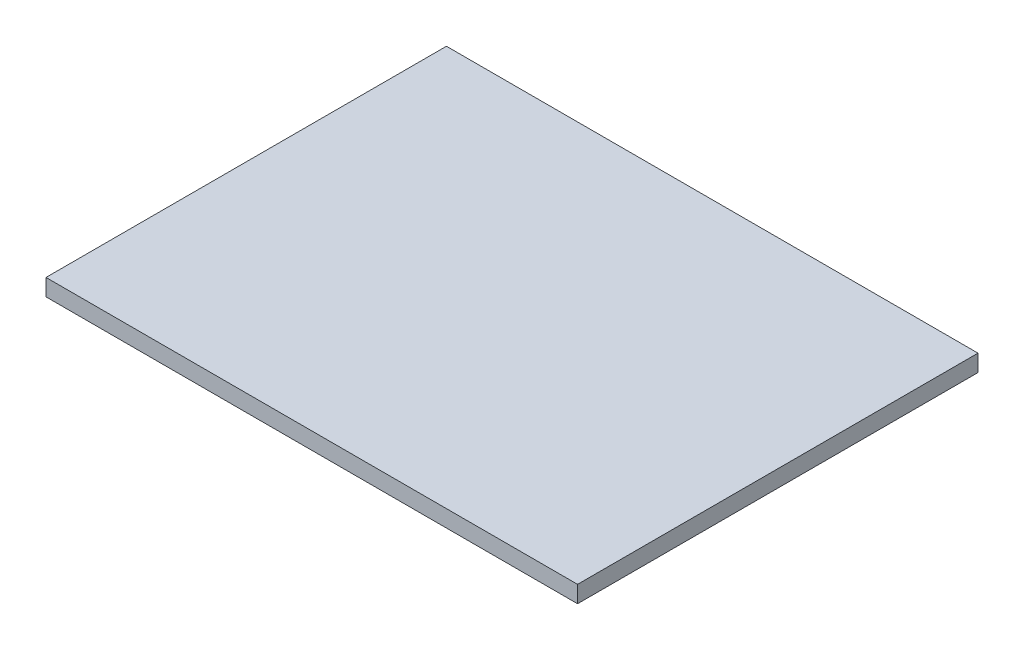
from build123d import *

# Parameters (mm, degrees)
SKETCH_2_W      = 300
SKETCH_2_H      = 226
EXTRUDE_1_DEPTH = 9.5


with BuildPart() as part:
    # 草图2 → 凸台-拉伸1 (new body)
    with BuildSketch(Plane(origin=(0, 0, 0), x_dir=(1, 0, 0), z_dir=(0, 1, 0))):
        Rectangle(SKETCH_2_W, SKETCH_2_H)
    extrude(amount=EXTRUDE_1_DEPTH)


solid = part.part
